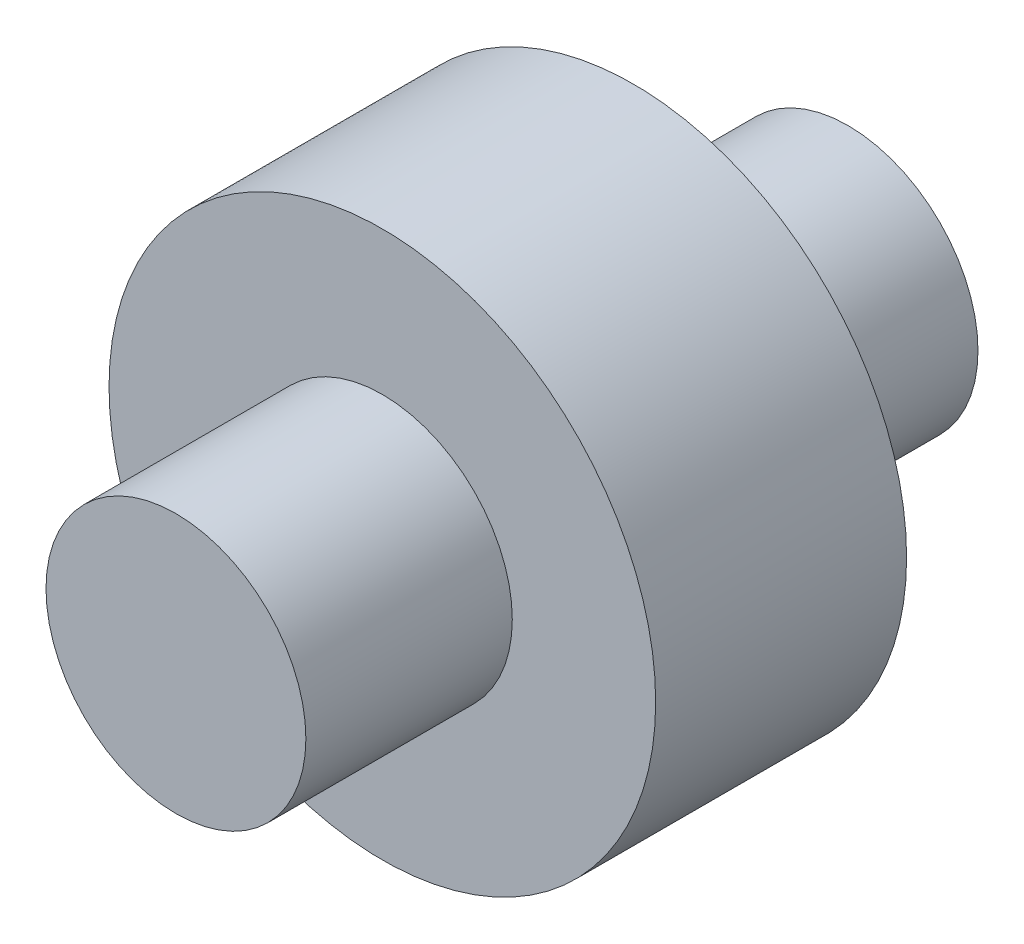
from build123d import *


with BuildPart() as part:
    # Sketch3 → Revolve1 (revolve)
    with BuildSketch(Plane(origin=(0, 0, 0), x_dir=(0, 0, -1), z_dir=(1, 0, 0))):
        Polygon((-6.875165628, 1.8415), (-3.949933487, 1.8415), (-3.949933487, 3.8735), (-0.393933487, 3.8735), (-0.393933487, 1.8415), (2.649834372, 1.8415), (2.649834372, 0), (-6.875165628, 0), align=None)
    revolve(axis=Axis((0, 0, 6.875165628), (0, 0, -1)))


solid = part.part
